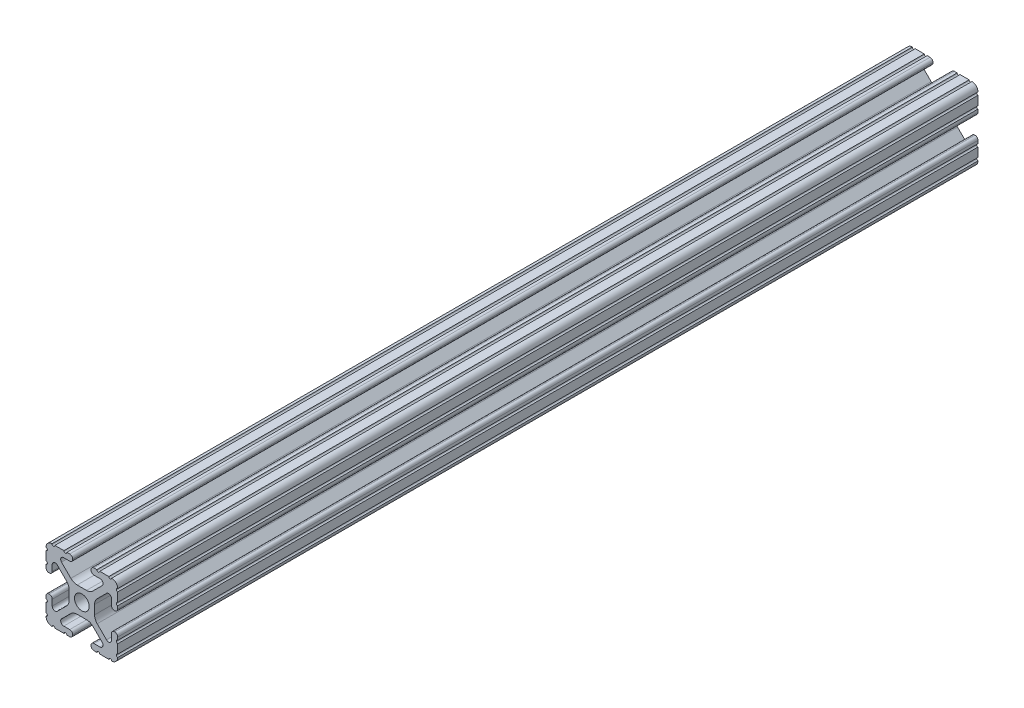
from build123d import *

# Parameters (mm, degrees)
SKETCH1_R               = 2.6035
BOSS_EXTRUDE1_DEPTH     = 152.4
CUT_EXTRUDE1_DEPTH      = 156.02325632
CUT_EXTRUDE1_DEPTH_BACK = 156.02325632
SKETCH2_R               = 3.175


with BuildPart() as part:
    # Sketch1 → Boss-Extrude1 (new, symmetric)
    with BuildSketch(Plane.XY):
        with BuildLine():
            Line((-7.179650497, -8.645192506), (-3.952270251, -5.423690499))
            ThreePointArc((-3.952270251, -5.423690499), (-2.922936451, -4.736929036), (-1.709253557, -4.4958))
            Line((-1.709253557, -4.4958), (1.709253557, -4.4958))
            ThreePointArc((1.709253557, -4.4958), (2.922936451, -4.736929036), (3.952270251, -5.423690499))
            Line((3.952270251, -5.423690499), (7.179650497, -8.645192506))
            ThreePointArc((7.179650497, -8.645192506), (7.41473083, -9.822813117), (6.416408329, -10.4902))
            Line((6.416408329, -10.4902), (4.287512407, -10.4902))
            ThreePointArc((4.287512407, -10.4902), (3.54574862, -10.79744862), (3.2385, -11.539212407))
            Line((3.2385, -11.539212407), (3.2385, -11.650987593))
            ThreePointArc((3.2385, -11.650987593), (3.54574862, -12.39275138), (4.287512407, -12.7))
            Line((4.287512407, -12.7), (5.317126718, -12.7))
            ThreePointArc((5.317126718, -12.7), (5.825126718, -12.192), (6.333126718, -12.7))
            Line((6.333126718, -12.7), (9.550443118, -12.7))
            ThreePointArc((9.550443118, -12.7), (10.058366869, -12.192000006), (10.566443095, -12.699847501))
            ThreePointArc((10.566443095, -12.699847501), (12.082537762, -12.08250727), (12.699846982, -10.566399977))
            ThreePointArc((12.699846982, -10.566399977), (12.192000006, -10.058323491), (12.7, -9.5504))
            Line((12.7, -9.5504), (12.7, -6.3330836))
            ThreePointArc((12.7, -6.3330836), (12.192, -5.8250836), (12.7, -5.3170836))
            Line((12.7, -5.3170836), (12.7, -4.287469289))
            ThreePointArc((12.7, -4.287469289), (12.39275138, -3.545705502), (11.650987593, -3.238456882))
            Line((11.650987593, -3.238456882), (11.539212407, -3.238456882))
            ThreePointArc((11.539212407, -3.238456882), (10.79744862, -3.545705502), (10.4902, -4.287469289))
            Line((10.4902, -4.287469289), (10.4902, -6.402089023))
            ThreePointArc((10.4902, -6.402089023), (9.856505071, -7.351067942), (8.737131347, -7.129408934))
            Line((8.737131347, -7.129408934), (5.441005833, -3.840816462))
            ThreePointArc((5.441005833, -3.840816462), (4.750877967, -2.809883091), (4.5085, -1.593185507))
            Line((4.5085, -1.593185507), (4.5085, 1.593185507))
            ThreePointArc((4.5085, 1.593185507), (4.750877967, 2.809883091), (5.441005833, 3.840816462))
            Line((5.441005833, 3.840816462), (8.737131347, 7.129408934))
            ThreePointArc((8.737131347, 7.129408934), (9.856505071, 7.351067942), (10.4902, 6.402089023))
            Line((10.4902, 6.402089023), (10.4902, 4.287469289))
            ThreePointArc((10.4902, 4.287469289), (10.79744862, 3.545705502), (11.539212407, 3.238456882))
            Line((11.539212407, 3.238456882), (11.650987593, 3.238456882))
            ThreePointArc((11.650987593, 3.238456882), (12.39275138, 3.545705502), (12.7, 4.287469289))
            Line((12.7, 4.287469289), (12.7, 5.3170836))
            ThreePointArc((12.7, 5.3170836), (12.192, 5.8250836), (12.7, 6.3330836))
            Line((12.7, 6.3330836), (12.7, 9.5504))
            ThreePointArc((12.7, 9.5504), (12.192000006, 10.058323491), (12.699846982, 10.566399977))
            ThreePointArc((12.699846982, 10.566399977), (12.082537762, 12.08250727), (10.566443095, 12.699847501))
            ThreePointArc((10.566443095, 12.699847501), (10.058366869, 12.192000006), (9.550443118, 12.7))
            Line((9.550443118, 12.7), (6.333126718, 12.7))
            ThreePointArc((6.333126718, 12.7), (5.825126718, 12.192), (5.317126718, 12.7))
            Line((5.317126718, 12.7), (4.287512407, 12.7))
            ThreePointArc((4.287512407, 12.7), (3.54574862, 12.39275138), (3.2385, 11.650987593))
            Line((3.2385, 11.650987593), (3.2385, 11.539212407))
            ThreePointArc((3.2385, 11.539212407), (3.54574862, 10.79744862), (4.287512407, 10.4902))
            Line((4.287512407, 10.4902), (6.476788598, 10.4902))
            ThreePointArc((6.476788598, 10.4902), (7.432222385, 9.85140422), (7.207036008, 8.724370562))
            Line((7.207036008, 8.724370562), (3.898272566, 5.423169045))
            ThreePointArc((3.898272566, 5.423169045), (2.869120213, 4.736787962), (1.655778399, 4.4958))
            Line((1.655778399, 4.4958), (-1.655778399, 4.4958))
            ThreePointArc((-1.655778399, 4.4958), (-2.869120213, 4.736787962), (-3.898272566, 5.423169045))
            Line((-3.898272566, 5.423169045), (-7.207036008, 8.724370562))
            ThreePointArc((-7.207036008, 8.724370562), (-7.432222385, 9.85140422), (-6.476788598, 10.4902))
            Line((-6.476788598, 10.4902), (-4.287512407, 10.4902))
            ThreePointArc((-4.287512407, 10.4902), (-3.54574862, 10.79744862), (-3.2385, 11.539212407))
            Line((-3.2385, 11.539212407), (-3.2385, 11.650987593))
            ThreePointArc((-3.2385, 11.650987593), (-3.54574862, 12.39275138), (-4.287512407, 12.7))
            Line((-4.287512407, 12.7), (-5.317126718, 12.7))
            ThreePointArc((-5.317126718, 12.7), (-5.825126718, 12.192), (-6.333126718, 12.7))
            Line((-6.333126718, 12.7), (-9.550443118, 12.7))
            ThreePointArc((-9.550443118, 12.7), (-10.058366869, 12.192000006), (-10.566443095, 12.699847501))
            ThreePointArc((-10.566443095, 12.699847501), (-12.082537762, 12.08250727), (-12.699846982, 10.566399977))
            ThreePointArc((-12.699846982, 10.566399977), (-12.192000006, 10.058323491), (-12.7, 9.5504))
            Line((-12.7, 9.5504), (-12.7, 6.3330836))
            ThreePointArc((-12.7, 6.3330836), (-12.192, 5.8250836), (-12.7, 5.3170836))
            Line((-12.7, 5.3170836), (-12.7, 4.287469289))
            ThreePointArc((-12.7, 4.287469289), (-12.39275138, 3.545705502), (-11.650987593, 3.238456882))
            Line((-11.650987593, 3.238456882), (-11.539212407, 3.238456882))
            ThreePointArc((-11.539212407, 3.238456882), (-10.79744862, 3.545705502), (-10.4902, 4.287469289))
            Line((-10.4902, 4.287469289), (-10.4902, 6.402089023))
            ThreePointArc((-10.4902, 6.402089023), (-9.856505071, 7.351067942), (-8.737131347, 7.129408934))
            Line((-8.737131347, 7.129408934), (-5.441005833, 3.840816462))
            ThreePointArc((-5.441005833, 3.840816462), (-4.750877967, 2.809883091), (-4.5085, 1.593185507))
            Line((-4.5085, 1.593185507), (-4.5085, -1.593185507))
            ThreePointArc((-4.5085, -1.593185507), (-4.750877967, -2.809883091), (-5.441005833, -3.840816462))
            Line((-5.441005833, -3.840816462), (-8.737131347, -7.129408934))
            ThreePointArc((-8.737131347, -7.129408934), (-9.856505071, -7.351067942), (-10.4902, -6.402089023))
            Line((-10.4902, -6.402089023), (-10.4902, -4.287469289))
            ThreePointArc((-10.4902, -4.287469289), (-10.79744862, -3.545705502), (-11.539212407, -3.238456882))
            Line((-11.539212407, -3.238456882), (-11.650987593, -3.238456882))
            ThreePointArc((-11.650987593, -3.238456882), (-12.39275138, -3.545705502), (-12.7, -4.287469289))
            Line((-12.7, -4.287469289), (-12.7, -5.3170836))
            ThreePointArc((-12.7, -5.3170836), (-12.192, -5.8250836), (-12.7, -6.3330836))
            Line((-12.7, -6.3330836), (-12.7, -9.5504))
            ThreePointArc((-12.7, -9.5504), (-12.192000006, -10.058323491), (-12.699846982, -10.566399977))
            ThreePointArc((-12.699846982, -10.566399977), (-12.082537762, -12.08250727), (-10.566443095, -12.699847501))
            ThreePointArc((-10.566443095, -12.699847501), (-10.058366869, -12.192000006), (-9.550443118, -12.7))
            Line((-9.550443118, -12.7), (-6.333126718, -12.7))
            ThreePointArc((-6.333126718, -12.7), (-5.825126718, -12.192), (-5.317126718, -12.7))
            Line((-5.317126718, -12.7), (-4.287512407, -12.7))
            ThreePointArc((-4.287512407, -12.7), (-3.54574862, -12.39275138), (-3.2385, -11.650987593))
            Line((-3.2385, -11.650987593), (-3.2385, -11.539212407))
            ThreePointArc((-3.2385, -11.539212407), (-3.54574862, -10.79744862), (-4.287512407, -10.4902))
            Line((-4.287512407, -10.4902), (-6.416408329, -10.4902))
            ThreePointArc((-6.416408329, -10.4902), (-7.41473083, -9.822813117), (-7.179650497, -8.645192506))
        make_face()
        Circle(SKETCH1_R, mode=Mode.SUBTRACT)
    extrude(amount=BOSS_EXTRUDE1_DEPTH, both=True)

    # Sketch2 → Cut-Extrude1 (cut, two sides: drawn at the far end of the back side and taken through both)
    with BuildSketch(Plane(origin=(0, 12.7, 0), x_dir=(1, 0, 0), z_dir=(0, 1, 0)).offset(-CUT_EXTRUDE1_DEPTH_BACK)):
        with Locations((0, -88.9)):
            Circle(SKETCH2_R)
        with Locations((0, 127)):
            Circle(SKETCH2_R)
    extrude(amount=CUT_EXTRUDE1_DEPTH + CUT_EXTRUDE1_DEPTH_BACK, mode=Mode.SUBTRACT)


solid = part.part
